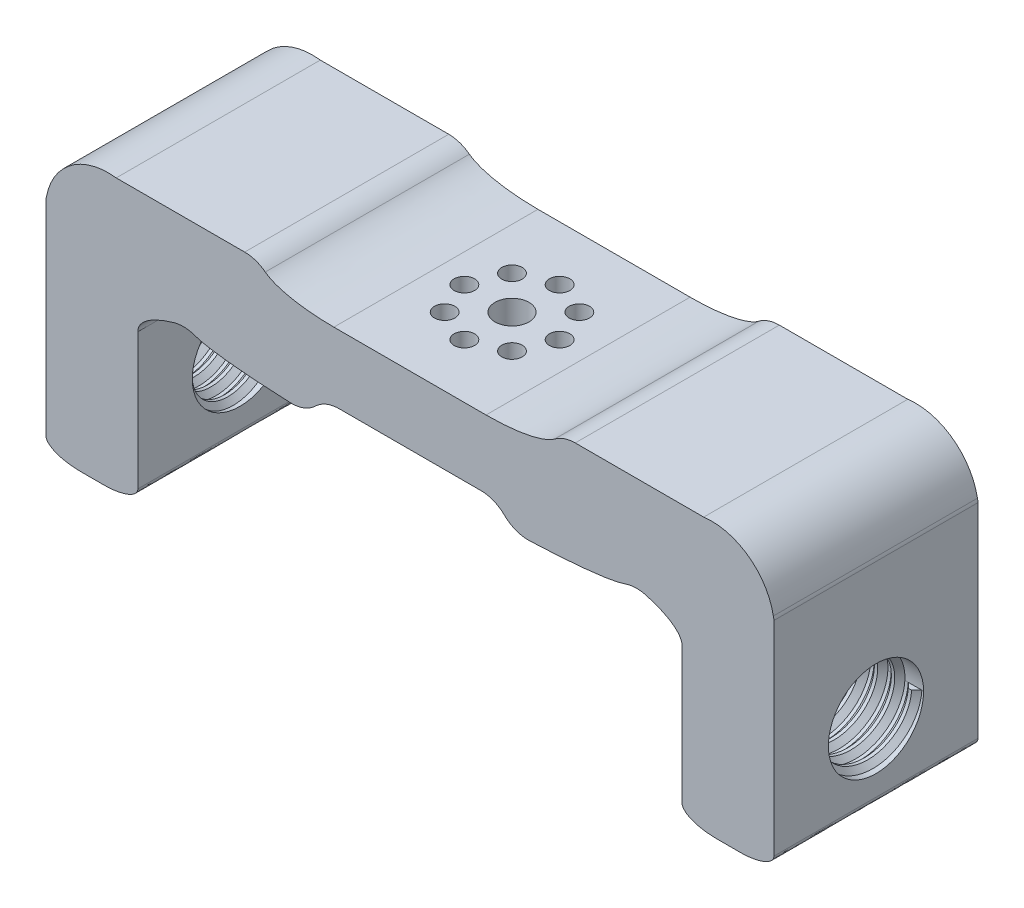
from build123d import *

# Parameters (mm, degrees)
EXTRUDE_1_DEPTH      = 30
SKETCH_2_R           = 7
CUT_EXTRUDE_1_DEPTH  = 92.669327613
SWEEP_1_PITCH        = 2.5
SKETCH_9_R           = 1.5
SKETCH_9_R_2         = 2.5
CUT_EXTRUDE_2_DEPTH  = 79.962092099
FILLET_2_SIZE        = 15
FILLET_2_SIZE_2      = 5
FILLET_3_SIZE        = 5
FILLET_3_SIZE_2      = 15
SKETCH_18_W          = 13.5
SKETCH_18_H          = 30
EXTRUDE_3_DEPTH      = 2
EXTRUDE_4_DEPTH      = 3
EXTRUDE_4_DEPTH_BACK = 2
SKETCH_19_W          = 24
SKETCH_19_H          = 30
FILLET_4_DEPTH       = 30
FILLET_5_R           = 11
SKETCH_20_W          = 17.5
SKETCH_20_H          = 30
EXTRUDE_5_DEPTH      = 3
FILLET_6_R           = 5
FILLET_START         = -1
FILLET_7_DEPTH       = 32
FILLET_8_R           = 5
FILLET_9_R           = 5
FILLET_10_R          = 5
FILLET_11_DEPTH      = 30
FILLET_12_SIZE       = 5
FILLET_12_SIZE_2     = 2
EXTRUDE_6_DEPTH      = 30


with BuildPart() as part:
    # 草图1 → 凸台-拉伸1 (new body)
    with BuildSketch(Plane.XY):
        Polygon((10.609375, 68.125), (64.109375, 68.125), (64.109375, 33.125), (50.609375, 33.125), (50.609375, 58.125), (10.609375, 58.125), align=None)
    extrude(amount=EXTRUDE_1_DEPTH)

    # 草图2 → 切除-拉伸1 (cut, through all)
    with BuildSketch(Plane(origin=(64.109375, 0, 0), x_dir=(0, 0, -1), z_dir=(1, 0, 0))):
        with Locations((-15, 43.125)):
            Circle(SKETCH_2_R)
    extrude(amount=-CUT_EXTRUDE_1_DEPTH, mode=Mode.SUBTRACT)

    # 扫描1: arcs per turn and ends read off the stored shape
    # 扫描1: the profile of 草图6 profile screwed along a right-hand helix through 4.5 turns, 10 arcs to a turn; built about Z, then put on its axis
    sweep_1_z = Axis((0, 0, 0), (0, 0, 1))
    sweep_1_corners = [(7.0003, 0, 1.0003), (7.0003, 0, -1.0003), (6.25, 0, -0.25), (6.25, 0, 0.25)]
    with BuildLine(mode=Mode.PRIVATE) as sweep_1_profile:
        Line(sweep_1_corners[0], sweep_1_corners[1])
        Line(sweep_1_corners[1], sweep_1_corners[2])
        Line(sweep_1_corners[2], sweep_1_corners[3])
        Line(sweep_1_corners[3], sweep_1_corners[0])
    sweep_1_cap = Face(sweep_1_profile.wire())
    sweep_1_turn_angles = [0, 18, 36, 54, 72, 90, 108, 126, 144, 162, 180, 198, 216, 234, 252, 270, 288, 306, 324, 342, 360]
    sweep_1_turn_weights = [1, 0.9510565162951535, 1, 0.9510565162951535, 1, 0.9510565162951535, 1, 0.9510565162951535, 1, 0.9510565162951535, 1, 0.9510565162951535, 1, 0.9510565162951535, 1, 0.9510565162951535, 1, 0.9510565162951535, 1, 0.9510565162951535, 1]
    sweep_1_turn_rails = [Edge.make_bspline([Vector(p[0], p[1], 0).rotate(sweep_1_z, sweep_1_turn_angles[k]) / sweep_1_turn_weights[k] + Vector(0, 0, p[2] + SWEEP_1_PITCH * sweep_1_turn_angles[k] / 360) for k in range(21)], [0, 0, 0, 1, 1, 2, 2, 3, 3, 4, 4, 5, 5, 6, 6, 7, 7, 8, 8, 9, 9, 10, 10, 10], 2, sweep_1_turn_weights) for p in sweep_1_corners]
    sweep_1_turn_sides = [Face.make_surface_from_curves(sweep_1_turn_rails[p[0]], sweep_1_turn_rails[p[1]]) for p in [(0, 1), (1, 2), (2, 3), (3, 0)]]
    sweep_1_last_angles = [1440, 1458, 1476, 1494, 1512, 1530, 1548, 1566, 1584, 1602, 1620]
    sweep_1_last_weights = [1, 0.9510565162951535, 1, 0.9510565162951535, 1, 0.9510565162951535, 1, 0.9510565162951535, 1, 0.9510565162951474, 1]
    sweep_1_last_rails = [Edge.make_bspline([Vector(p[0], p[1], 0).rotate(sweep_1_z, sweep_1_last_angles[k]) / sweep_1_last_weights[k] + Vector(0, 0, p[2] + SWEEP_1_PITCH * sweep_1_last_angles[k] / 360) for k in range(11)], [0, 0, 0, 1, 1, 2, 2, 3, 3, 4, 4, 5, 5, 5], 2, sweep_1_last_weights) for p in sweep_1_corners]
    sweep_1_last_sides = [Face.make_surface_from_curves(sweep_1_last_rails[p[0]], sweep_1_last_rails[p[1]]) for p in [(0, 1), (1, 2), (2, 3), (3, 0)]]
    sweep_1 = Plane(origin=(62.859375, 43.125, 15), x_dir=(0, 0, -1), z_dir=(-1, 0, 0)) * Solid(Shell([*[p.moved(Location((0, 0, SWEEP_1_PITCH * i))) for i in range(4) for p in sweep_1_turn_sides], *sweep_1_last_sides, sweep_1_cap, sweep_1_cap.rotate(sweep_1_z, 1620).moved(Location((0, 0, SWEEP_1_PITCH * 1620 / 360)))]))
    add(sweep_1)

    # 镜向1: part across plane


with BuildPart() as part_1:
    add(part.part)
    add(part.part.mirror(Plane(origin=(10.609375, 0, 0), x_dir=(0, 0, 1), z_dir=(1, 0, 0))))

    # 草图9 → 切除-拉伸2 (cut, through all)
    with BuildSketch(Plane(origin=(0, 68.125, 0), x_dir=(1, 0, 0), z_dir=(0, 1, 0))):
        with Locations(Location((3.609375, -15, 0), (0, 0, 270))):
            Circle(SKETCH_9_R)
        with Locations(Location((5.659627532, -19.949747468, 0), (0, 0, 270))):
            Circle(SKETCH_9_R)
        with Locations(Location((10.609375, -22, 0), (0, 0, 270))):
            Circle(SKETCH_9_R)
        with Locations(Location((10.609375, -15, 0), (0, 0, 270))):
            Circle(SKETCH_9_R_2)
        with Locations(Location((15.559122468, -19.949747468, 0), (0, 0, 270))):
            Circle(SKETCH_9_R)
        with Locations(Location((17.609375, -15, 0), (0, 0, 270))):
            Circle(SKETCH_9_R)
        with Locations(Location((15.559122468, -10.050252532, 0), (0, 0, 270))):
            Circle(SKETCH_9_R)
        with Locations(Location((10.609375, -8, 0), (0, 0, 270))):
            Circle(SKETCH_9_R)
        with Locations(Location((5.659627532, -10.050252532, 0), (0, 0, 270))):
            Circle(SKETCH_9_R)
    extrude(amount=-CUT_EXTRUDE_2_DEPTH, mode=Mode.SUBTRACT)

    # 圆角2
    # a fillet whose section is not a circle: 15, 5 mm, written as the material it adds along each edge
    with BuildSketch(Plane(origin=(-29.390625, 58.125, 0), x_dir=(1, 0, 0), z_dir=(0, 0, 1))) as fillet_2_piece_1:
        with BuildLine():
            Bezier((FILLET_2_SIZE, 0), (0, 0), (0, -FILLET_2_SIZE_2), weights=[1, 0.707106781, 1])
            Line((0, -FILLET_2_SIZE_2), (0, 0))
            Line((0, 0), (FILLET_2_SIZE, 0))
        make_face()
    extrude(amount=30)
    with BuildSketch(Plane(origin=(50.609375, 58.125, 0), x_dir=(0, -1, 0), z_dir=(0, 0, 1))) as fillet_2_piece_2:
        with BuildLine():
            Bezier((FILLET_2_SIZE_2, 0), (0, 0), (0, -FILLET_2_SIZE), weights=[1, 0.707106781, 1])
            Line((0, -FILLET_2_SIZE), (0, 0))
            Line((0, 0), (FILLET_2_SIZE_2, 0))
        make_face()
    extrude(amount=30)

    # 圆角3
    # a fillet whose section is not a circle: 15, 5 mm, written as the material it takes off along each edge
    with BuildSketch(Plane(origin=(-42.890625, 68.125, -37.5), x_dir=(0, -1, 0), z_dir=(0, 0, 1))) as fillet_3_piece_1:
        with BuildLine():
            Bezier((FILLET_3_SIZE, 0), (0, 0), (0, FILLET_3_SIZE_2), weights=[1, 0.707106781, 1])
            Line((0, FILLET_3_SIZE_2), (0, 0))
            Line((0, 0), (FILLET_3_SIZE, 0))
        make_face()
    extrude(amount=105, mode=Mode.SUBTRACT)
    with BuildSketch(Plane(origin=(64.109375, 68.125, -37.5), x_dir=(-1, 0, 0), z_dir=(0, 0, 1))) as fillet_3_piece_2:
        with BuildLine():
            Bezier((FILLET_3_SIZE_2, 0), (0, 0), (0, FILLET_3_SIZE), weights=[1, 0.707106781, 1])
            Line((0, FILLET_3_SIZE), (0, 0))
            Line((0, 0), (FILLET_3_SIZE_2, 0))
        make_face()
    extrude(amount=105, mode=Mode.SUBTRACT)

    # 草图18 → 凸台-拉伸3 (add)
    with BuildSketch(Plane.XZ.offset(-33.125)):
        with Locations((-36.140625, 15)):
            Rectangle(SKETCH_18_W, SKETCH_18_H)
        with Locations((57.359375, 15)):
            Rectangle(SKETCH_18_W, SKETCH_18_H)
    extrude(amount=EXTRUDE_3_DEPTH)

    # 草图19 → 凸台-拉伸4 (add, two sides: drawn at the far end of the back side and taken through both)
    with BuildSketch(Plane(origin=(0, 68.125, 0), x_dir=(1, 0, 0), z_dir=(0, 1, 0)).offset(-EXTRUDE_4_DEPTH_BACK)):
        with Locations((-23.390625, -15)):
            Rectangle(SKETCH_19_W, SKETCH_19_H)
        with Locations((44.609375, -15)):
            Rectangle(SKETCH_19_W, SKETCH_19_H)
    extrude(amount=EXTRUDE_4_DEPTH + EXTRUDE_4_DEPTH_BACK)

    # 圆角4: read off the stored shape, not the designer's step
    # 圆角4 outline → 圆角4 (add)
    with BuildSketch(Plane.XY):
        with BuildLine():
            Line((-11.390625, 68.125), (-0.573971174, 68.125))
            add(Edge.make_bspline(
                [(-0.573971174, 68.125), (-10.835924804, 68.125), (-11.390625, 71.125)],
                knots=[0, 0, 0, 1, 1, 1], degree=2, weights=[1, 0.768706115, 1]))
            Line((-11.390625, 71.125), (-11.390625, 68.125))
        make_face()
        with BuildLine():
            add(Edge.make_bspline(
                [(21.792721174, 68.125), (32.054674804, 68.125), (32.609375, 71.125)],
                knots=[0, 0, 0, 1, 1, 1], degree=2, weights=[1, 0.768706115, 1]))
            Line((21.792721174, 68.125), (32.609375, 68.125))
            Line((32.609375, 68.125), (32.609375, 71.125))
        make_face()
    extrude(amount=FILLET_4_DEPTH)

    # 圆角5
    # the kernel refuses this fillet: 11 mm, written as the material it adds along each edge
    with BuildSketch(Plane(origin=(56.609375, 67.455127019, 30), x_dir=(0.9539027762319419, -0.3001158001455332, 0), z_dir=(0, 0, -1))) as fillet_5_piece_1:
        with BuildLine():
            CenterArc((7.082101602, -10.851247344), FILLET_5_R, 99.433313823, 38.635977016)
            Line((-1.101386866, -3.500702025), (-1.265056636, -3.353691119))
            ThreePointArc((-1.265056636, -3.353691119), (-0.760552044, -1.684325537), (-0.209858611, 0.066025476))
            Line((-0.209858611, 0.066025476), (0.025176181, 0.218554707))
            ThreePointArc((0.025176181, 0.218554707), (2.640119055, 0.044271644), (5.243148505, 0.217024947))
            Line((5.243148505, 0.217024947), (5.279206409, 0))
        make_face()
    extrude(amount=30)
    with BuildSketch(Plane(origin=(-35.390625, 67.455127019, 30), x_dir=(-0.9539027762319403, -0.3001158001455388, 0), z_dir=(0, 0, -1))) as fillet_5_piece_2:
        with BuildLine():
            CenterArc((7.082101602, 10.851247344), FILLET_5_R, 221.930709161, 38.635977016)
            Line((-1.101386866, 3.500702025), (-1.265056636, 3.353691119))
            ThreePointArc((-1.265056636, 3.353691119), (-0.760552044, 1.684325537), (-0.209858611, -0.066025476))
            Line((-0.209858611, -0.066025476), (0.025176181, -0.218554707))
            ThreePointArc((0.025176181, -0.218554707), (2.640119055, -0.044271644), (5.243148505, -0.217024947))
            Line((5.243148505, -0.217024947), (5.279206409, 0))
        make_face()
    extrude(amount=30)

    # 草图20 → 凸台-拉伸5 (add)
    with BuildSketch(Plane.XZ.offset(-58.125)):
        with Locations((-13.140625, 15)):
            Rectangle(SKETCH_20_W, SKETCH_20_H)
        with Locations((34.359375, 15)):
            Rectangle(SKETCH_20_W, SKETCH_20_H)
    extrude(amount=EXTRUDE_5_DEPTH)

    # 圆角6
    # the kernel refuses this fillet: 5 mm, written as the material it adds along each edge
    with BuildSketch(Plane(origin=(25.609375, 58.125, 30), x_dir=(-1, 0, 0), z_dir=(0, 0, -1))) as fillet_6_piece_1:
        with BuildLine():
            CenterArc((4.582575695, -5), FILLET_6_R, 90, 66.421821522)
            Line((0, -3), (-0.091651514, -2.96))
            ThreePointArc((-0.091651514, -2.96), (-0.1, -1.5), (-0.1, 0))
            Line((-0.1, 0), (0, 0.1))
            Line((0, 0.1), (4.582575695, 0.1))
            Line((4.582575695, 0.1), (4.582575695, 0))
        make_face()
    extrude(amount=30)
    with BuildSketch(Plane(origin=(-4.390625, 58.125, 30), x_dir=(1, 0, 0), z_dir=(0, 0, -1))) as fillet_6_piece_2:
        with BuildLine():
            CenterArc((4.582575695, 5), FILLET_6_R, 203.578178478, 66.421821522)
            Line((0, 3), (-0.091651514, 2.96))
            ThreePointArc((-0.091651514, 2.96), (-0.1, 1.5), (-0.1, 0))
            Line((-0.1, 0), (0, -0.1))
            Line((0, -0.1), (4.582575695, -0.1))
            Line((4.582575695, -0.1), (4.582575695, 0))
        make_face()
    extrude(amount=30)

    # 圆角7: read off the stored shape, not the designer's step
    # 圆角7 outline → 圆角7 (cut)
    with BuildSketch(Plane.XY.offset(FILLET_START)):
        with BuildLine():
            add(Edge.make_bspline(
                [(-21.890625, 57.455127019), (-21.702112093, 55.700035895), (-4.346899318, 55.222341307)],
                knots=[0, 0, 0, 0.80403126, 0.80403126, 0.80403126], degree=2, weights=[1, 0.794093133, 0.919297382]))
            Line((-21.890625, 57.455127019), (-21.890625, 55.125))
            Line((-21.890625, 55.125), (-4.390625, 55.125))
            add(Edge.make_bspline(
                [(-4.390625, 55.125), (-4.3692824, 55.173902039), (-4.346899318, 55.222341307)],
                knots=[0, 0, 0, 0.019421233, 0.019421233, 0.019421233], degree=2, weights=[1, 0.996827736, 0.993778691]))
        make_face()
        with BuildLine():
            add(Edge.make_bspline(
                [(25.565649318, 55.222341307), (42.920862093, 55.700035895), (43.109375, 57.455127019)],
                knots=[0.19596874, 0.19596874, 0.19596874, 1, 1, 1], degree=2, weights=[0.919297382, 0.794093133, 1]))
            add(Edge.make_bspline(
                [(25.609375, 55.125), (25.5880324, 55.173902039), (25.565649318, 55.222341307)],
                knots=[0, 0, 0, 0.019421233, 0.019421233, 0.019421233], degree=2, weights=[1, 0.996827736, 0.993778691]))
            Line((25.609375, 55.125), (43.109375, 55.125))
            Line((43.109375, 55.125), (43.109375, 57.455127019))
        make_face()
    extrude(amount=FILLET_7_DEPTH, mode=Mode.SUBTRACT)

    # 圆角8
    fillet_8_edges = [part_1.edges().sort_by_distance(p)[0] for p in [
        (-35.390625, 71.125, 15),
        (56.609375, 71.125, 15),
    ]]
    fillet(fillet_8_edges, radius=FILLET_8_R)

    # 圆角9
    fillet_9_edges = [part_1.edges().sort_by_distance(p)[0] for p in [
        (32.609375, 71.125, 15),
        (-11.390625, 71.125, 15),
    ]]
    fillet(fillet_9_edges, radius=FILLET_9_R)

    # 圆角10
    fillet_10_edges = [part_1.edges().sort_by_distance(p)[0] for p in [
        (-4.346899318, 55.222341307, 15),
        (25.565649318, 55.222341307, 15),
    ]]
    fillet(fillet_10_edges, radius=FILLET_10_R)

    # 圆角11: read off the stored shape, not the designer's step
    # 圆角11 outline → 圆角11 (add)
    with BuildSketch(Plane.XY):
        with BuildLine():
            add(Edge.make_bspline(
                [(-21.023761301, 56.842290462), (-22.524933582, 57.378925736), (-24.059678149, 56.947585094)],
                knots=[0, 0, 0, 1, 1, 1], degree=2, weights=[1, 0.952744047, 1]))
            add(Edge.make_bspline(
                [(-21.890625, 57.455127019), (-21.856785838, 57.140077969), (-21.023761301, 56.842290462)],
                knots=[0, 0, 0, 0.173668828, 0.173668828, 0.173668828], degree=2, weights=[1, 0.955524609, 0.926497197]))
            add(Edge.make_bspline(
                [(-24.059678149, 56.947585094), (-23.042661501, 57.233418075), (-21.890625, 57.455127019)],
                knots=[0.551268593, 0.551268593, 0.551268593, 0.658919323, 0.658919323, 0.658919323], degree=2, weights=[0.855093112, 0.858326127, 0.868347633]))
        make_face()
        with BuildLine():
            add(Edge.make_bspline(
                [(42.242511301, 56.842290462), (43.075535838, 57.140077969), (43.109375, 57.455127019)],
                knots=[0.826331172, 0.826331172, 0.826331172, 1, 1, 1], degree=2, weights=[0.926497197, 0.955524609, 1]))
            add(Edge.make_bspline(
                [(42.242511301, 56.842290462), (43.743683582, 57.378925736), (45.278428149, 56.947585094)],
                knots=[0, 0, 0, 1, 1, 1], degree=2, weights=[1, 0.952744047, 1]))
            add(Edge.make_bspline(
                [(43.109375, 57.455127019), (44.261411919, 57.233417957), (45.278428149, 56.947585094)],
                knots=[0.341080722, 0.341080722, 0.341080722, 0.448731407, 0.448731407, 0.448731407], degree=2, weights=[0.868347624, 0.858326125, 0.855093112]))
        make_face()
    extrude(amount=FILLET_11_DEPTH)

    # 圆角12
    # a fillet whose section is not a circle: 5, 2 mm, written as the material it takes off along each edge
    with BuildSketch(Plane(origin=(64.109375, 31.125, 42.5), x_dir=(-1, 0, 0), z_dir=(0, 0, -1)), Plane(origin=(-42.890625, 31.125, -12.5), x_dir=(1, 0, 0), z_dir=(0, 0, 1))) as fillet_12_piece_1:
        with BuildLine():
            Bezier((FILLET_12_SIZE, 0), (0, 0), (0, FILLET_12_SIZE_2), weights=[1, 0.707106781, 1])
            Line((0, FILLET_12_SIZE_2), (0, 0))
            Line((0, 0), (FILLET_12_SIZE, 0))
        make_face()
    extrude(amount=55, mode=Mode.SUBTRACT)
    with BuildSketch(Plane(origin=(50.609375, 31.125, -12.5), x_dir=(0, 1, 0), z_dir=(0, 0, 1)), Plane(origin=(-29.390625, 31.125, 42.5), x_dir=(0, 1, 0), z_dir=(0, 0, -1))) as fillet_12_piece_2:
        with BuildLine():
            Bezier((FILLET_12_SIZE_2, 0), (0, 0), (0, -FILLET_12_SIZE), weights=[1, 0.707106781, 1])
            Line((0, -FILLET_12_SIZE), (0, 0))
            Line((0, 0), (FILLET_12_SIZE_2, 0))
        make_face()
    extrude(amount=55, mode=Mode.SUBTRACT)

    # 草图23 → 凸台-拉伸6 (add)
    with BuildSketch(Plane.XY.offset(30)):
        with BuildLine():
            Line((-42.890625, 63.125), (-32.569795117, 71.125))
            ThreePointArc((-32.569795117, 71.125), (-39.387064308, 69.262513856), (-42.890625, 63.125))
        make_face()
        with BuildLine():
            Line((53.788545117, 71.125), (64.109375, 63.125))
            ThreePointArc((64.109375, 63.125), (60.605814308, 69.262513856), (53.788545117, 71.125))
        make_face()
    extrude(amount=-EXTRUDE_6_DEPTH)


solid = part_1.part
